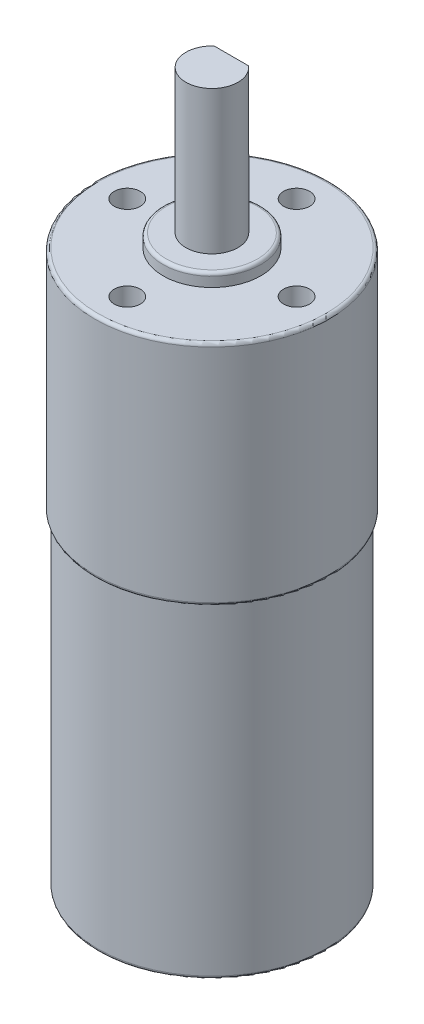
from build123d import *

# Parameters (mm, degrees)
SKETCH_1_R          = 17.5
EXTRUDE_1_DEPTH     = 50
SKETCH_3_R          = 18
EXTRUDE_4_DEPTH     = 35
SKETCH_4_R          = 7.5
EXTRUDE_5_DEPTH     = 2
SKETCH_5_R          = 4
EXTRUDE_6_DEPTH     = 22
SKETCH_6_R          = 2
CUT_EXTRUDE_1_DEPTH = 5
SKETCH_7_W          = 8.061647896
SKETCH_7_H          = 1.71902786
CUT_EXTRUDE_2_DEPTH = 18
FILLET_10_R         = 0.5
FILLET_11_R         = 0.5
FILLET_12_R         = 0.5
FILLET_13_R         = 0.5


with BuildPart() as part:
    # 草图1 → 凸台-拉伸1 (new body)
    with BuildSketch(Plane(origin=(0, 0, 0), x_dir=(1, 0, 0), z_dir=(0, 1, 0))):
        with Locations(Location((0, 0, 0), (0, 0, 270))):
            Circle(SKETCH_1_R)
    extrude(amount=EXTRUDE_1_DEPTH)

    # 草图3 → 凸台-拉伸4 (add)
    with BuildSketch(Plane(origin=(0, 50, 0), x_dir=(1, 0, 0), z_dir=(0, 1, 0))):
        with Locations(Location((0, 0, 0), (0, 0, 270))):
            Circle(SKETCH_3_R)
    extrude(amount=EXTRUDE_4_DEPTH)

    # 草图4 → 凸台-拉伸5 (add)
    with BuildSketch(Plane(origin=(0, 85, 0), x_dir=(1, 0, 0), z_dir=(0, 1, 0))):
        with Locations(Location((0, 0, 0), (0, 0, 270))):
            Circle(SKETCH_4_R)
    extrude(amount=EXTRUDE_5_DEPTH)

    # 草图5 → 凸台-拉伸6 (add)
    with BuildSketch(Plane(origin=(0, 87, 0), x_dir=(1, 0, 0), z_dir=(0, 1, 0))):
        with Locations(Location((0, 0, 0), (0, 0, 270))):
            Circle(SKETCH_5_R)
    extrude(amount=EXTRUDE_6_DEPTH)

    # 草图6 → 切除-拉伸1 (cut)
    with BuildSketch(Plane(origin=(0, 85, 0), x_dir=(1, 0, 0), z_dir=(0, 1, 0))):
        with Locations(Location((0, 13, 0), (0, 0, 270))):
            Circle(SKETCH_6_R)
        with Locations(Location((13, 0, 0), (0, 0, 270))):
            Circle(SKETCH_6_R)
        with Locations(Location((0, -13, 0), (0, 0, 270))):
            Circle(SKETCH_6_R)
        with Locations(Location((-13, 0, 0), (0, 0, 270))):
            Circle(SKETCH_6_R)
    extrude(amount=-CUT_EXTRUDE_1_DEPTH, mode=Mode.SUBTRACT)

    # 草图7 → 切除-拉伸2 (cut)
    with BuildSketch(Plane(origin=(0, 109, 0), x_dir=(1, 0, 0), z_dir=(0, 1, 0))):
        with Locations((-0.414937759, 3.85951393)):
            Rectangle(SKETCH_7_W, SKETCH_7_H)
    extrude(amount=-CUT_EXTRUDE_2_DEPTH, mode=Mode.SUBTRACT)

    # 圆角10
    fillet_10_edges = [part.edges().sort_by_distance(p)[0] for p in [
        (0, 85, -18),
    ]]
    fillet(fillet_10_edges, radius=FILLET_10_R)

    # 圆角11
    fillet_11_edges = [part.edges().sort_by_distance(p)[0] for p in [
        (0, 50, -18),
    ]]
    fillet(fillet_11_edges, radius=FILLET_11_R - 0.0001)  # a hair under: the kernel refuses the full size

    # 圆角12
    fillet_12_edges = [part.edges().sort_by_distance(p)[0] for p in [
        (0, 0, -17.5),
    ]]
    fillet(fillet_12_edges, radius=FILLET_12_R)

    # 圆角13
    fillet_13_edges = [part.edges().sort_by_distance(p)[0] for p in [
        (0, 87, -7.5),
    ]]
    fillet(fillet_13_edges, radius=FILLET_13_R)


solid = part.part
